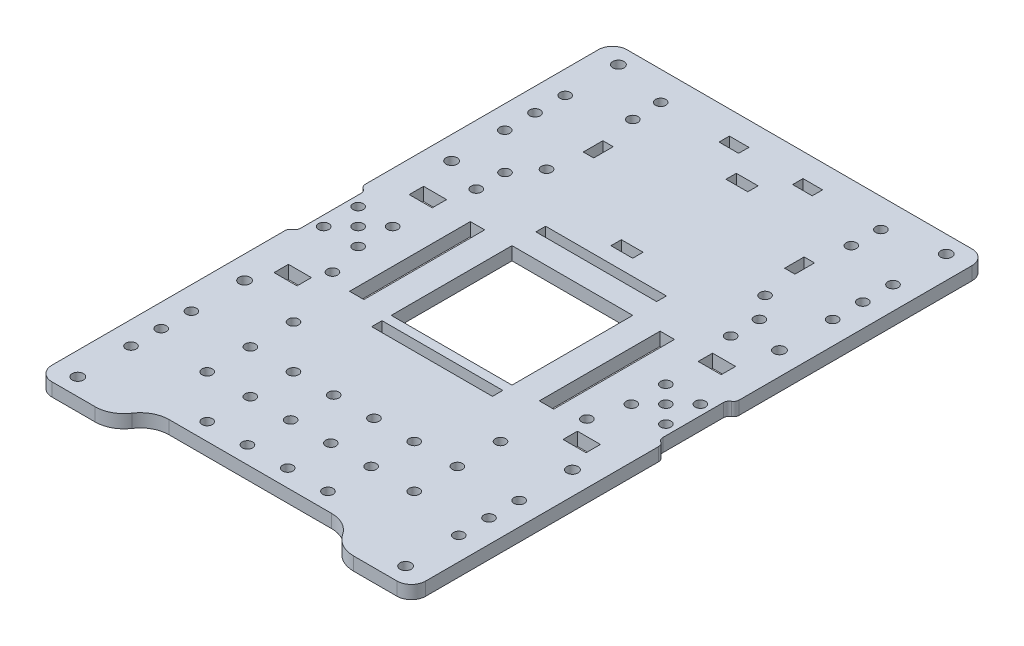
from build123d import *

# Parameters (mm, degrees)
SKETCH_2_W           = 130
SKETCH_2_H           = 200
SKETCH_2_R           = 1.8
EXTRUDE_1_DEPTH      = 4.6
FILLET_1_R           = 5
SKETCH_3_W           = 4
SKETCH_3_H           = 24
CUT_EXTRUDE_1_DEPTH  = 4.6
FILLET_2_R           = 2
FILLET_3_R           = 2
SKETCH_4_R           = 1.8
SKETCH_4_R_2         = 1.95
CUT_EXTRUDE_2_DEPTH  = 4.6
SKETCH_5_R           = 1.8
SKETCH_5_W           = 6.8
SKETCH_5_H           = 3.6
SKETCH_5_W_2         = 42
SKETCH_5_H_2         = 42
SKETCH_5_H_3         = 3.4
SKETCH_5_W_3         = 70
SKETCH_5_H_4         = 18
CUT_EXTRUDE_3_DEPTH  = 4.6
FILLET_4_R           = 10
FILLET_5_R           = 10
SKETCH_6_R           = 1.8
CUT_EXTRUDE_4_DEPTH  = 4.6
SKETCH_7_R           = 1.8
CUT_EXTRUDE_5_DEPTH  = 4.6
SKETCH_8_W           = 7.56096601
SKETCH_8_H           = 3.597038402
SKETCH_8_H_2         = 3.621629188
SKETCH_8_W_2         = 3.6
SKETCH_8_H_3         = 6.8
CUT_EXTRUDE_6_DEPTH  = 4.6
SKETCH_10_R          = 1.8
CUT_EXTRUDE_8_DEPTH  = 4.6
SKETCH_9_W           = 8
SKETCH_9_H           = 5
SKETCH_9_W_2         = 5
SKETCH_9_H_2         = 42
CUT_EXTRUDE_9_DEPTH  = 4.6
EXTRUDE_START        = 2
SKETCH_12_W          = 18.75
SKETCH_12_H          = 71.5
SKETCH_12_R          = 1.95
SKETCH_12_R_2        = 1.8
SKETCH_12_R_3        = 1.814304703
SKETCH_12_W_2        = 4
SKETCH_12_H_2        = 2
SKETCH_12_W_3        = 44.25
SKETCH_12_H_3        = 9.499668345
SKETCH_12_H_4        = 71.502072164
SKETCH_12_H_5        = 4.00066331
SKETCH_12_H_6        = 10.999668345
SKETCH_12_H_7        = 10.799999999
SKETCH_12_W_4        = 15.750000002
SKETCH_12_H_8        = 4
SKETCH_12_W_5        = 24.499999998
SKETCH_12_W_6        = 24.5
SKETCH_12_W_7        = 15.75
SKETCH_12_H_9        = 11
SKETCH_12_H_10       = 10.8
SKETCH_12_H_11       = 0.5
SKETCH_12_W_8        = 15.750000003
SKETCH_12_W_9        = 3.999999999
SKETCH_12_W_10       = 14.75
SKETCH_12_H_12       = 76.497927836
SKETCH_12_H_13       = 76.5
SKETCH_12_H_14       = 11.97
SKETCH_12_H_15       = 9.167588033
SKETCH_12_H_16       = 0.69
SKETCH_12_H_17       = 1.832411967
SKETCH_12_H_18       = 1.142411967
SKETCH_12_H_19       = 1.059701493
SKETCH_12_H_20       = 8.290597014
SKETCH_12_H_21       = 1.559701493
EXTRUDE_2_DEPTH      = 2
SKETCH_13_W          = 30
SKETCH_13_H          = 4
EXTRUDE_3_DEPTH      = 2
FILLET_6_R           = 5
SKETCH_14_W          = 42
SKETCH_14_H          = 3.4
EXTRUDE_4_DEPTH      = 4.6
SKETCH_15_W          = 42
SKETCH_15_H          = 3.6
CUT_EXTRUDE_10_DEPTH = 10
SKETCH_16_W          = 204.995685258
SKETCH_16_H          = 218.219063178
CUT_EXTRUDE_11_DEPTH = 2


# Some blends are built 0.0001 mm under size
with BuildPart() as part:
    # 草图2 → 凸台-拉伸1 (new body)
    with BuildSketch(Plane(origin=(0, 0, 0), x_dir=(1, 0, 0), z_dir=(0, 1, 0))):
        Rectangle(SKETCH_2_W, SKETCH_2_H)
        with Locations(Location((-59.5, 6, 0), (0, 0, 270))):
            Circle(SKETCH_2_R, mode=Mode.SUBTRACT)
        with Locations(Location((-47.5, 6, 0), (0, 0, 270))):
            Circle(SKETCH_2_R, mode=Mode.SUBTRACT)
        with Locations(Location((-59.5, -6, 0), (0, 0, 270))):
            Circle(SKETCH_2_R, mode=Mode.SUBTRACT)
        with Locations(Location((-47.5, -6, 0), (0, 0, 270))):
            Circle(SKETCH_2_R, mode=Mode.SUBTRACT)
        with Locations(Location((-53.5, 0, 0), (0, 0, 270))):
            Circle(SKETCH_2_R, mode=Mode.SUBTRACT)
        with Locations(Location((53.5, 0, 0), (0, 0, 270))):
            Circle(SKETCH_2_R, mode=Mode.SUBTRACT)
        with Locations(Location((59.5, 6, 0), (0, 0, 270))):
            Circle(SKETCH_2_R, mode=Mode.SUBTRACT)
        with Locations(Location((59.5, -6, 0), (0, 0, 270))):
            Circle(SKETCH_2_R, mode=Mode.SUBTRACT)
        with Locations(Location((47.5, -6, 0), (0, 0, 270))):
            Circle(SKETCH_2_R, mode=Mode.SUBTRACT)
        with Locations(Location((47.5, 6, 0), (0, 0, 270))):
            Circle(SKETCH_2_R, mode=Mode.SUBTRACT)
    extrude(amount=EXTRUDE_1_DEPTH)

    # 圆角1
    fillet_1_edges = [part.edges().sort_by_distance(p)[0] for p in [
        (65, 2.3, 100),
        (-65, 2.3, 100),
        (-65, 2.3, -100),
        (65, 2.3, -100),
    ]]
    fillet(fillet_1_edges, radius=FILLET_1_R)

    # 草图3 → 切除-拉伸1 (cut)
    with BuildSketch(Plane(origin=(0, 4.6, 0), x_dir=(1, 0, 0), z_dir=(0, 1, 0))):
        with Locations((-65, 0)):
            Rectangle(SKETCH_3_W, SKETCH_3_H)
        with Locations((65, 0)):
            Rectangle(SKETCH_3_W, SKETCH_3_H)
    extrude(amount=-CUT_EXTRUDE_1_DEPTH, mode=Mode.SUBTRACT)

    # 圆角2
    fillet_2_edges = [part.edges().sort_by_distance(p)[0] for p in [
        (65, 2.3, 12),
        (65, 2.3, -12),
        (-65, 2.3, 12),
        (-65, 2.3, -12),
    ]]
    fillet(fillet_2_edges, radius=FILLET_2_R - 0.0001)  # a hair under: the kernel refuses the full size

    # 圆角3
    fillet_3_edges = [part.edges().sort_by_distance(p)[0] for p in [
        (-63, 2.3, 12),
        (-63, 2.3, -12),
        (63, 2.3, -12),
        (63, 2.3, 12),
    ]]
    fillet(fillet_3_edges, radius=FILLET_3_R)

    # 草图4 → 切除-拉伸2 (cut)
    with BuildSketch(Plane(origin=(0, 0, 0), x_dir=(1, 0, 0), z_dir=(0, 1, 0))):
        with Locations(Location((57, 65, 0), (0, 0, 270))):
            Circle(SKETCH_4_R)
        with Locations(Location((57, 75.5, 0), (0, 0, 270))):
            Circle(SKETCH_4_R)
        with Locations(Location((57, 54.5, 0), (0, 0, 270))):
            Circle(SKETCH_4_R)
        with Locations(Location((57, 94, 0), (0, 0, 270))):
            Circle(SKETCH_4_R_2)
        with Locations(Location((57, 36, 0), (0, 0, 270))):
            Circle(SKETCH_4_R_2)
        with Locations(Location((-57, 94, 0), (0, 0, 270))):
            Circle(SKETCH_4_R_2)
        with Locations(Location((-57, 75.5, 0), (0, 0, 270))):
            Circle(SKETCH_4_R)
        with Locations(Location((-57, 65, 0), (0, 0, 270))):
            Circle(SKETCH_4_R)
        with Locations(Location((-57, 54.5, 0), (0, 0, 270))):
            Circle(SKETCH_4_R)
        with Locations(Location((-57, 36, 0), (0, 0, 270))):
            Circle(SKETCH_4_R_2)
        with Locations(Location((-57, -36, 0), (0, 0, 270))):
            Circle(SKETCH_4_R_2)
        with Locations(Location((-57, -65, 0), (0, 0, 270))):
            Circle(SKETCH_4_R)
        with Locations(Location((-57, -54.5, 0), (0, 0, 270))):
            Circle(SKETCH_4_R)
        with Locations(Location((-57, -75.5, 0), (0, 0, 270))):
            Circle(SKETCH_4_R)
        with Locations(Location((-57, -94, 0), (0, 0, 270))):
            Circle(SKETCH_4_R_2)
        with Locations(Location((57, -65, 0), (0, 0, 270))):
            Circle(SKETCH_4_R)
        with Locations(Location((57, -75.5, 0), (0, 0, 270))):
            Circle(SKETCH_4_R)
        with Locations(Location((57, -54.5, 0), (0, 0, 270))):
            Circle(SKETCH_4_R)
        with Locations(Location((57, -36, 0), (0, 0, 270))):
            Circle(SKETCH_4_R_2)
        with Locations(Location((57, -94, 0), (0, 0, 270))):
            Circle(SKETCH_4_R_2)
    extrude(amount=CUT_EXTRUDE_2_DEPTH, mode=Mode.SUBTRACT)

    # 草图5 → 切除-拉伸3 (cut)
    with BuildSketch(Plane(origin=(0, 4.6, 0), x_dir=(1, 0, 0), z_dir=(0, 1, 0))):
        with Locations(Location((38.3, 90, 0), (0, 0, 270))):
            Circle(SKETCH_5_R)
        with Locations(Location((-38.3, 90, 0), (0, 0, 270))):
            Circle(SKETCH_5_R)
        with Locations((-12.8, 90)):
            Rectangle(SKETCH_5_W, SKETCH_5_H)
        with Locations((12.8, 90)):
            Rectangle(SKETCH_5_W, SKETCH_5_H)
        Rectangle(SKETCH_5_W_2, SKETCH_5_H_2)
        with Locations((0, 31)):
            Rectangle(SKETCH_5_W_2, SKETCH_5_H_3)
        with Locations((0, -31)):
            Rectangle(SKETCH_5_W_2, SKETCH_5_H_3)
        with Locations((0, -100)):
            Rectangle(SKETCH_5_W_3, SKETCH_5_H_4)
    extrude(amount=-CUT_EXTRUDE_3_DEPTH, mode=Mode.SUBTRACT)

    # 圆角4
    # the kernel refuses this fillet: 10 mm, written as the material it takes off along each edge
    with BuildSketch(Plane(origin=(-35, -24.874685928, 100), x_dir=(-1, 0, 0), z_dir=(0, 1, 0))) as fillet_4_piece_1:
        with BuildLine():
            CenterArc((9.949874371, -10), FILLET_4_R, 90, 84.260829523)
            Line((0, -9), (-0.198997487, -8.98))
            ThreePointArc((-0.198997487, -8.98), (-0.2, -4.5), (-0.2, 0))
            Line((-0.2, 0), (0, 0.2))
            Line((0, 0.2), (9.949874371, 0.2))
            Line((9.949874371, 0.2), (9.949874371, 0))
        make_face()
    extrude(amount=54.349371855, mode=Mode.SUBTRACT)
    with BuildSketch(Plane(origin=(35, 29.474685928, 100), x_dir=(0, 0, -1), z_dir=(0, -1, 0))) as fillet_4_piece_2:
        with BuildLine():
            CenterArc((10, 9.949874371), FILLET_4_R, 180, 84.260829523)
            Line((0, 9.949874371), (-0.2, 9.949874371))
            Line((-0.2, 9.949874371), (-0.2, 0))
            Line((-0.2, 0), (0, -0.2))
            ThreePointArc((0, -0.2), (4.5, -0.2), (8.98, -0.198997487))
            Line((8.98, -0.198997487), (9, 0))
        make_face()
    extrude(amount=54.349371855, mode=Mode.SUBTRACT)

    # 圆角5
    fillet_5_edges = [part.edges().sort_by_distance(p)[0] for p in [
        (35, 2.3, 91),
        (-35, 2.3, 91),
    ]]
    fillet(fillet_5_edges, radius=FILLET_5_R)

    # 草图6 → 切除-拉伸4 (cut)
    with BuildSketch(Plane(origin=(0, 4.6, 0), x_dir=(1, 0, 0), z_dir=(0, 1, 0))):
        with Locations(Location((-7, -85, 0), (0, 0, 270))):
            Circle(SKETCH_6_R)
        with Locations(Location((-21, -85, 0), (0, 0, 270))):
            Circle(SKETCH_6_R)
        with Locations(Location((7, -85, 0), (0, 0, 270))):
            Circle(SKETCH_6_R)
        with Locations(Location((21, -85, 0), (0, 0, 270))):
            Circle(SKETCH_6_R)
        with Locations(Location((21, -70, 0), (0, 0, 270))):
            Circle(SKETCH_6_R)
        with Locations(Location((7, -70, 0), (0, 0, 270))):
            Circle(SKETCH_6_R)
        with Locations(Location((-7, -70, 0), (0, 0, 270))):
            Circle(SKETCH_6_R)
        with Locations(Location((-21, -70, 0), (0, 0, 270))):
            Circle(SKETCH_6_R)
        with Locations(Location((-21, -55, 0), (0, 0, 270))):
            Circle(SKETCH_6_R)
        with Locations(Location((-7, -55, 0), (0, 0, 270))):
            Circle(SKETCH_6_R)
        with Locations(Location((7, -55, 0), (0, 0, 270))):
            Circle(SKETCH_6_R)
        with Locations(Location((21, -55, 0), (0, 0, 270))):
            Circle(SKETCH_6_R)
        with Locations(Location((36, -70, 0), (0, 0, 270))):
            Circle(SKETCH_6_R)
        with Locations(Location((36, -55, 0), (0, 0, 270))):
            Circle(SKETCH_6_R)
        with Locations(Location((36, -40, 0), (0, 0, 270))):
            Circle(SKETCH_6_R)
        with Locations(Location((-36, -40, 0), (0, 0, 270))):
            Circle(SKETCH_6_R)
        with Locations(Location((-36, -55, 0), (0, 0, 270))):
            Circle(SKETCH_6_R)
        with Locations(Location((-36, -70, 0), (0, 0, 270))):
            Circle(SKETCH_6_R)
    extrude(amount=-CUT_EXTRUDE_4_DEPTH, mode=Mode.SUBTRACT)

    # 草图7 → 切除-拉伸5 (cut)
    with BuildSketch(Plane(origin=(0, 4.6, 0), x_dir=(1, 0, 0), z_dir=(0, 1, 0))):
        with Locations(Location((-38, 80, 0), (0, 0, 270))):
            Circle(SKETCH_7_R)
        with Locations(Location((38, 80, 0), (0, 0, 270))):
            Circle(SKETCH_7_R)
        with Locations(Location((38, 50, 0), (0, 0, 270))):
            Circle(SKETCH_7_R)
        with Locations(Location((-38, 50, 0), (0, 0, 270))):
            Circle(SKETCH_7_R)
    extrude(amount=-CUT_EXTRUDE_5_DEPTH, mode=Mode.SUBTRACT)

    # 草图8 → 切除-拉伸6 (cut)
    with BuildSketch(Plane(origin=(0, 4.6, 0), x_dir=(1, 0, 0), z_dir=(0, 1, 0))):
        with Locations((0, 80)):
            Rectangle(SKETCH_8_W, SKETCH_8_H)
        with Locations((0, 40)):
            Rectangle(SKETCH_8_W, SKETCH_8_H_2)
        with Locations((35, 65)):
            Rectangle(SKETCH_8_W_2, SKETCH_8_H_3)
        with Locations((-35, 65)):
            Rectangle(SKETCH_8_W_2, SKETCH_8_H_3)
    extrude(amount=-CUT_EXTRUDE_6_DEPTH, mode=Mode.SUBTRACT)

    # 草图10 → 切除-拉伸8 (cut)
    with BuildSketch(Plane(origin=(0, 4.6, 0), x_dir=(1, 0, 0), z_dir=(0, 1, 0))):
        with Locations(Location((44.25, 41.8, 0), (0, 0, 270))):
            Circle(SKETCH_10_R)
        with Locations(Location((-44.25, 41.810125838, 0), (0, 0, 270))):
            Circle(SKETCH_10_R)
        with Locations(Location((-44.25, -18.189874162, 0), (0, 0, 270))):
            Circle(SKETCH_10_R)
        with Locations(Location((44.25, -18.2, 0), (0, 0, 270))):
            Circle(SKETCH_10_R)
        with Locations(Location((-44.25, 31.810125838, 0), (0, 0, 270))):
            Circle(SKETCH_10_R)
        with Locations(Location((44.25, 31.810125838, 0), (0, 0, 270))):
            Circle(SKETCH_10_R)
    extrude(amount=-CUT_EXTRUDE_8_DEPTH, mode=Mode.SUBTRACT)

    # 草图9 → 切除-拉伸9 (cut)
    with BuildSketch(Plane(origin=(0, 4.6, 0), x_dir=(1, 0, 0), z_dir=(0, 1, 0))):
        with Locations((-50.25, 21)):
            Rectangle(SKETCH_9_W, SKETCH_9_H)
        with Locations((50.25, 21)):
            Rectangle(SKETCH_9_W, SKETCH_9_H)
        with Locations((-50.25, -26)):
            Rectangle(SKETCH_9_W, SKETCH_9_H)
        with Locations((50.25, -26)):
            Rectangle(SKETCH_9_W, SKETCH_9_H)
        with Locations((33, 0)):
            Rectangle(SKETCH_9_W_2, SKETCH_9_H_2)
        with Locations((-33, 0)):
            Rectangle(SKETCH_9_W_2, SKETCH_9_H_2)
    extrude(amount=-CUT_EXTRUDE_9_DEPTH, mode=Mode.SUBTRACT)

    # 草图12 → 凸台-拉伸2 (add)
    # profile 1 of 46: a face of its own
    with BuildSketch(Plane.XZ.offset(EXTRUDE_START)):
        with Locations((-55.625, 64.25)):
            Rectangle(SKETCH_12_W, SKETCH_12_H)
        with Locations(Location((-57, 36, 0), (0, 0, 270))):
            Circle(SKETCH_12_R, mode=Mode.SUBTRACT)
        with Locations(Location((-57, 54.5, 0), (0, 0, 270))):
            Circle(SKETCH_12_R_2, mode=Mode.SUBTRACT)
        with Locations(Location((-57, 65, 0), (0, 0, 270))):
            Circle(SKETCH_12_R_3, mode=Mode.SUBTRACT)
        with Locations(Location((-57, 75.5, 0), (0, 0, 270))):
            Circle(SKETCH_12_R_2, mode=Mode.SUBTRACT)
        with Locations(Location((-57, 94, 0), (0, 0, 270))):
            Circle(SKETCH_12_R, mode=Mode.SUBTRACT)
    # profile 2 of 46: a face of its own
    with BuildSketch(Plane.XZ.offset(EXTRUDE_START)):
        with Locations((0, 90)):
            Rectangle(SKETCH_12_W_2, SKETCH_12_H_2)
    # profile 3 of 46: a face of its own
    with BuildSketch(Plane.XZ.offset(EXTRUDE_START)):
        with Locations((24.125, 90)):
            Rectangle(SKETCH_12_W_3, SKETCH_12_H_2)
    # profile 4 of 46: a face of its own
    with BuildSketch(Plane.XZ.offset(EXTRUDE_START)):
        with Locations((-24.125, 90)):
            Rectangle(SKETCH_12_W_3, SKETCH_12_H_2)
    # profile 5 of 46: a face of its own
    with BuildSketch(Plane.XZ.offset(EXTRUDE_START)):
        with Locations((0, 84.250165828)):
            Rectangle(SKETCH_12_W_2, SKETCH_12_H_3)
    # profile 6 of 46: a face of its own
    with BuildSketch(Plane.XZ.offset(EXTRUDE_START)):
        with Locations((55.625, 64.251036082)):
            Rectangle(SKETCH_12_W, SKETCH_12_H_4)
        with Locations(Location((57, 36, 0), (0, 0, 270))):
            Circle(SKETCH_12_R, mode=Mode.SUBTRACT)
        with Locations(Location((57, 54.5, 0), (0, 0, 270))):
            Circle(SKETCH_12_R_2, mode=Mode.SUBTRACT)
        with Locations(Location((57, 65, 0), (0, 0, 270))):
            Circle(SKETCH_12_R_2, mode=Mode.SUBTRACT)
        with Locations(Location((57, 75.5, 0), (0, 0, 270))):
            Circle(SKETCH_12_R_2, mode=Mode.SUBTRACT)
        with Locations(Location((57, 94, 0), (0, 0, 270))):
            Circle(SKETCH_12_R, mode=Mode.SUBTRACT)
    # profile 7 of 46: a face of its own
    with BuildSketch(Plane.XZ.offset(EXTRUDE_START)):
        with Locations((24.125, 77.5)):
            Rectangle(SKETCH_12_W_3, SKETCH_12_H_5)
    # profile 8 of 46: a face of its own
    with BuildSketch(Plane.XZ.offset(EXTRUDE_START)):
        with Locations((0, 77.5)):
            Rectangle(SKETCH_12_W_2, SKETCH_12_H_5)
    # profile 9 of 46: a face of its own
    with BuildSketch(Plane.XZ.offset(EXTRUDE_START)):
        with Locations((-24.125, 77.5)):
            Rectangle(SKETCH_12_W_3, SKETCH_12_H_5)
    # profile 10 of 46: a face of its own
    with BuildSketch(Plane.XZ.offset(EXTRUDE_START)):
        with Locations((0, 69.999834173)):
            Rectangle(SKETCH_12_W_2, SKETCH_12_H_6)
    # profile 11 of 46: a face of its own
    with BuildSketch(Plane.XZ.offset(EXTRUDE_START)):
        with Locations((28.5, 69.9)):
            Rectangle(SKETCH_12_W_2, SKETCH_12_H_7)
    # profile 12 of 46: a face of its own
    with BuildSketch(Plane.XZ.offset(EXTRUDE_START)):
        with Locations((-28.499999998, 69.9)):
            Rectangle(SKETCH_12_W_2, SKETCH_12_H_7)
    # profile 13 of 46: a face of its own
    with BuildSketch(Plane.XZ.offset(EXTRUDE_START)):
        with Locations((-38.374999999, 62.5)):
            Rectangle(SKETCH_12_W_4, SKETCH_12_H_8)
    # profile 14 of 46: a face of its own
    with BuildSketch(Plane.XZ.offset(EXTRUDE_START)):
        with Locations((-28.499999998, 62.5)):
            Rectangle(SKETCH_12_W_2, SKETCH_12_H_8)
    # profile 15 of 46: a face of its own
    with BuildSketch(Plane.XZ.offset(EXTRUDE_START)):
        with Locations((-14.249999999, 62.5)):
            Rectangle(SKETCH_12_W_5, SKETCH_12_H_8)
    # profile 16 of 46: a face of its own
    with BuildSketch(Plane.XZ.offset(EXTRUDE_START)):
        with Locations((0, 62.5)):
            Rectangle(SKETCH_12_W_2, SKETCH_12_H_8)
    # profile 17 of 46: a face of its own
    with BuildSketch(Plane.XZ.offset(EXTRUDE_START)):
        with Locations((14.25, 62.5)):
            Rectangle(SKETCH_12_W_6, SKETCH_12_H_8)
    # profile 18 of 46: a face of its own
    with BuildSketch(Plane.XZ.offset(EXTRUDE_START)):
        with Locations((28.5, 62.5)):
            Rectangle(SKETCH_12_W_2, SKETCH_12_H_8)
    # profile 19 of 46: a face of its own
    with BuildSketch(Plane.XZ.offset(EXTRUDE_START)):
        with Locations((38.375, 62.5)):
            Rectangle(SKETCH_12_W_7, SKETCH_12_H_8)
    # profile 20 of 46: a face of its own
    with BuildSketch(Plane.XZ.offset(EXTRUDE_START)):
        with Locations((28.5, 55)):
            Rectangle(SKETCH_12_W_2, SKETCH_12_H_9)
    # profile 21 of 46: a face of its own
    with BuildSketch(Plane.XZ.offset(EXTRUDE_START)):
        with Locations((38.375, 47.5)):
            Rectangle(SKETCH_12_W_7, SKETCH_12_H_8)
    # profile 22 of 46: a face of its own
    with BuildSketch(Plane.XZ.offset(EXTRUDE_START)):
        with Locations((28.5, 40.1)):
            Rectangle(SKETCH_12_W_2, SKETCH_12_H_10)
    # profile 23 of 46: a face of its own
    with BuildSketch(Plane.XZ.offset(EXTRUDE_START)):
        Polygon((-46.25, 34.7), (-46.25, 32.7), (46.25, 32.7), (46.25, 34.7), (30.5, 34.7), (26.5, 34.7), (-26.499999999, 34.7), (-30.499999997, 34.7), align=None)
    # profile 24 of 46: a face of its own
    with BuildSketch(Plane.XZ.offset(EXTRUDE_START)):
        with Locations((28.5, 47.5)):
            Rectangle(SKETCH_12_W_2, SKETCH_12_H_8)
    # profile 25 of 46: a face of its own
    with BuildSketch(Plane.XZ.offset(EXTRUDE_START)):
        Polygon((-26.499999998, 49.5), (-26.499999998, 45.5), (26.5, 45.5), (26.5, 49.5), (2, 49.5), (2, 49), (-2, 49), (-2, 49.5), align=None)
    # profile 26 of 46: a face of its own
    with BuildSketch(Plane.XZ.offset(EXTRUDE_START)):
        with Locations((0, 55)):
            Rectangle(SKETCH_12_W_2, SKETCH_12_H_9)
    # profile 27 of 46: a face of its own
    with BuildSketch(Plane.XZ.offset(EXTRUDE_START)):
        with Locations((0, 49.25)):
            Rectangle(SKETCH_12_W_2, SKETCH_12_H_11)
    # profile 28 of 46: a face of its own
    with BuildSketch(Plane.XZ.offset(EXTRUDE_START)):
        Polygon((-30.499999998, 60.5), (-30.499999997, 49.5), (-26.499999998, 49.5), (-26.499999998, 60.5), align=None)
    # profile 29 of 46: a face of its own
    with BuildSketch(Plane.XZ.offset(EXTRUDE_START)):
        with Locations((-38.374999999, 47.5)):
            Rectangle(SKETCH_12_W_8, SKETCH_12_H_8)
    # profile 30 of 46: a face of its own
    with BuildSketch(Plane.XZ.offset(EXTRUDE_START)):
        with Locations((-28.499999998, 47.5)):
            Rectangle(SKETCH_12_W_9, SKETCH_12_H_8)
    # profile 31 of 46: a face of its own
    with BuildSketch(Plane.XZ.offset(EXTRUDE_START)):
        Polygon((-30.499999997, 45.5), (-30.499999997, 34.699999999), (-26.499999999, 34.7), (-26.499999998, 45.5), align=None)
    # profile 32 of 46: a face of its own
    with BuildSketch(Plane.XZ.offset(EXTRUDE_START)):
        with Locations((57.625, -61.748963918)):
            Rectangle(SKETCH_12_W_10, SKETCH_12_H_12)
        with Locations(Location((57, -94, 0), (0, 0, 270))):
            Circle(SKETCH_12_R, mode=Mode.SUBTRACT)
        with Locations(Location((57, -75.5, 0), (0, 0, 270))):
            Circle(SKETCH_12_R_2, mode=Mode.SUBTRACT)
        with Locations(Location((57, -65, 0), (0, 0, 270))):
            Circle(SKETCH_12_R_2, mode=Mode.SUBTRACT)
        with Locations(Location((57, -54.5, 0), (0, 0, 270))):
            Circle(SKETCH_12_R_2, mode=Mode.SUBTRACT)
        with Locations(Location((57, -36, 0), (0, 0, 270))):
            Circle(SKETCH_12_R, mode=Mode.SUBTRACT)
    # profile 33 of 46: a face of its own
    with BuildSketch(Plane.XZ.offset(EXTRUDE_START)):
        with Locations((-57.625, -61.75)):
            Rectangle(SKETCH_12_W_10, SKETCH_12_H_13)
        with Locations(Location((-57, -36, 0), (0, 0, 270))):
            Circle(SKETCH_12_R, mode=Mode.SUBTRACT)
        with Locations(Location((-57, -54.5, 0), (0, 0, 270))):
            Circle(SKETCH_12_R_2, mode=Mode.SUBTRACT)
        with Locations(Location((-57, -65, 0), (0, 0, 270))):
            Circle(SKETCH_12_R_2, mode=Mode.SUBTRACT)
        with Locations(Location((-57, -75.5, 0), (0, 0, 270))):
            Circle(SKETCH_12_R_2, mode=Mode.SUBTRACT)
        with Locations(Location((-57, -94, 0), (0, 0, 270))):
            Circle(SKETCH_12_R, mode=Mode.SUBTRACT)
    # profile 34 of 46: a face of its own
    with BuildSketch(Plane.XZ.offset(EXTRUDE_START)):
        Polygon((50.25, -54.875), (-50.25, -54.875), (-50.25, -58.875), (-2, -58.875), (2, -58.875), (50.25, -58.875), align=None)
    # profile 35 of 46: a face of its own
    with BuildSketch(Plane.XZ.offset(EXTRUDE_START)):
        with Locations((0, -64.86)):
            Rectangle(SKETCH_12_W_2, SKETCH_12_H_14)
    # profile 36 of 46: a face of its own
    with BuildSketch(Plane.XZ.offset(EXTRUDE_START)):
        Polygon((-2, -70.845), (-50.25, -70.845), (-50.25, -74.845), (-21.990241502, -74.845), (-21.990241502, -74.155), (-17.990241502, -74.155), (-17.990241502, -74.845), (17.990241502, -74.845), (21.990241502, -74.845), (50.25, -74.845), (50.25, -70.845), (2, -70.845), align=None)
    # profile 37 of 46: a face of its own
    with BuildSketch(Plane.XZ.offset(EXTRUDE_START)):
        with Locations((19.990241502, -79.428794017)):
            Rectangle(SKETCH_12_W_2, SKETCH_12_H_15)
    # profile 38 of 46: a face of its own
    with BuildSketch(Plane.XZ.offset(EXTRUDE_START)):
        with Locations((-19.990241502, -79.428794017)):
            Rectangle(SKETCH_12_W_2, SKETCH_12_H_15)
    # profile 39 of 46: a face of its own
    with BuildSketch(Plane.XZ.offset(EXTRUDE_START)):
        with Locations((-19.990241502, -74.5)):
            Rectangle(SKETCH_12_W_2, SKETCH_12_H_16)
    # profile 40 of 46: a face of its own
    with BuildSketch(Plane.XZ.offset(EXTRUDE_START)):
        Polygon((-50.25, -84.012588033), (-50.25, -86.012588033), (-2, -86.012588033), (-2, -84.95288654), (2, -84.95288654), (2, -86.012588033), (50.25, -86.012588033), (50.25, -84.012588033), (21.990241502, -84.012588033), (21.990241502, -85.155), (17.990241502, -85.155), (17.990241502, -84.012588033), (-17.990241502, -84.012588033), (-17.990241502, -85.845), (-21.990241502, -85.845), (-21.990241502, -84.012588033), align=None)
    # profile 41 of 46: a face of its own
    with BuildSketch(Plane.XZ.offset(EXTRUDE_START)):
        with Locations((-19.990241502, -84.928794017)):
            Rectangle(SKETCH_12_W_2, SKETCH_12_H_17)
    # profile 42 of 46: a face of its own
    with BuildSketch(Plane.XZ.offset(EXTRUDE_START)):
        with Locations((19.990241502, -84.583794017)):
            Rectangle(SKETCH_12_W_2, SKETCH_12_H_18)
    # profile 43 of 46: a face of its own
    with BuildSketch(Plane.XZ.offset(EXTRUDE_START)):
        with Locations((0, -85.482737286)):
            Rectangle(SKETCH_12_W_2, SKETCH_12_H_19)
    # profile 44 of 46: a face of its own
    with BuildSketch(Plane.XZ.offset(EXTRUDE_START)):
        with Locations((0, -90.15788654)):
            Rectangle(SKETCH_12_W_2, SKETCH_12_H_20)
    # profile 45 of 46: a face of its own
    with BuildSketch(Plane.XZ.offset(EXTRUDE_START)):
        Polygon((-50.25, -94.303185047), (-50.25, -97.303185047), (50.25, -97.303185047), (50.25, -94.303185047), (2, -94.303185047), (2, -95.86288654), (-2, -95.86288654), (-2, -94.303185047), align=None)
    # profile 46 of 46: a face of its own
    with BuildSketch(Plane.XZ.offset(EXTRUDE_START)):
        with Locations((0, -95.083035794)):
            Rectangle(SKETCH_12_W_2, SKETCH_12_H_21)
    extrude(amount=-EXTRUDE_2_DEPTH)

    # 草图13 → 凸台-拉伸3 (add)
    with BuildSketch(Plane.XZ):
        with Locations((0, -43.810814594)):
            Rectangle(SKETCH_13_W, SKETCH_13_H)
    extrude(amount=EXTRUDE_3_DEPTH)

    # 圆角6
    # the kernel refuses this fillet: 5 mm, written as the material it takes off along each edge
    with BuildSketch(Plane(origin=(-65, -2, -100), x_dir=(0, 0, 1), z_dir=(0, 1, 0)), Plane(origin=(-65, -2, 100), x_dir=(1, 0, 0), z_dir=(0, 1, 0)), Plane(origin=(65, -2, 100.002072164), x_dir=(0, 0, -1), z_dir=(0, 1, 0))) as fillet_6_piece_1:
        with BuildLine():
            CenterArc((FILLET_6_R, FILLET_6_R), FILLET_6_R, 180, 90)
            Line((0, FILLET_6_R), (-FILLET_6_R * 0.02, FILLET_6_R))
            Line((-FILLET_6_R * 0.02, FILLET_6_R), (-FILLET_6_R * 0.02, -FILLET_6_R * 0.02))
            Line((-FILLET_6_R * 0.02, -FILLET_6_R * 0.02), (FILLET_6_R, -FILLET_6_R * 0.02))
            Line((FILLET_6_R, -FILLET_6_R * 0.02), (FILLET_6_R, 0))
        make_face()
    extrude(amount=2, mode=Mode.SUBTRACT)
    with BuildSketch(Plane(origin=(65, -2, -99.997927836), x_dir=(0, 0, 1), z_dir=(0, 1, 0))) as fillet_6_piece_2:
        with BuildLine():
            CenterArc((FILLET_6_R, -FILLET_6_R), FILLET_6_R, 90, 90)
            Line((0, -FILLET_6_R), (-FILLET_6_R * 0.02, -FILLET_6_R))
            Line((-FILLET_6_R * 0.02, -FILLET_6_R), (-FILLET_6_R * 0.02, FILLET_6_R * 0.02))
            Line((-FILLET_6_R * 0.02, FILLET_6_R * 0.02), (FILLET_6_R, FILLET_6_R * 0.02))
            Line((FILLET_6_R, FILLET_6_R * 0.02), (FILLET_6_R, 0))
        make_face()
    extrude(amount=2, mode=Mode.SUBTRACT)

    # 草图14 → 凸台-拉伸4 (add)
    with BuildSketch(Plane(origin=(0, 4.6, 0), x_dir=(1, 0, 0), z_dir=(0, 1, 0))):
        with Locations((0, -31)):
            Rectangle(SKETCH_14_W, SKETCH_14_H)
    extrude(amount=-EXTRUDE_4_DEPTH)

    # 草图15 → 切除-拉伸10 (cut)
    with BuildSketch(Plane(origin=(0, 4.6, 0), x_dir=(1, 0, 0), z_dir=(0, 1, 0))):
        with Locations((0, -26)):
            Rectangle(SKETCH_15_W, SKETCH_15_H)
    extrude(amount=-CUT_EXTRUDE_10_DEPTH, mode=Mode.SUBTRACT)

    # 草图16 → 切除-拉伸11 (cut)
    with BuildSketch(Plane.XZ):
        Rectangle(SKETCH_16_W, SKETCH_16_H)
    extrude(amount=CUT_EXTRUDE_11_DEPTH, mode=Mode.SUBTRACT)


solid = part.part
